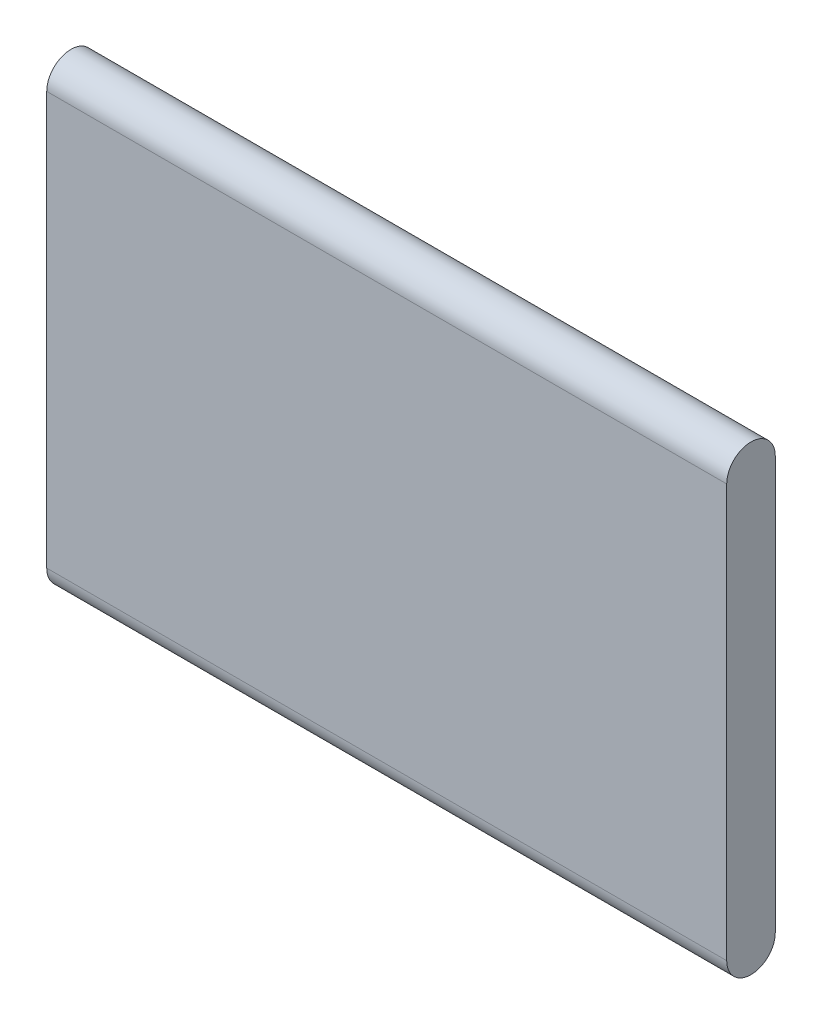
from build123d import *

# Parameters (mm, degrees)
BOSS_EXTRUDE1_DEPTH = 355.6


with BuildPart() as part:
    # Sketch1 → Boss-Extrude1 (new, symmetric)
    with BuildSketch(Plane(origin=(0, 0, 0), x_dir=(0, 0, -1), z_dir=(1, 0, 0))):
        with BuildLine():
            Line((-25.4, 215.9), (-25.4, -215.9))
            ThreePointArc((-25.4, -215.9), (0, -241.3), (25.4, -215.9))
            Line((25.4, -215.9), (25.4, 215.9))
            ThreePointArc((25.4, 215.9), (0, 241.3), (-25.4, 215.9))
        make_face()
    extrude(amount=BOSS_EXTRUDE1_DEPTH, both=True)


solid = part.part
